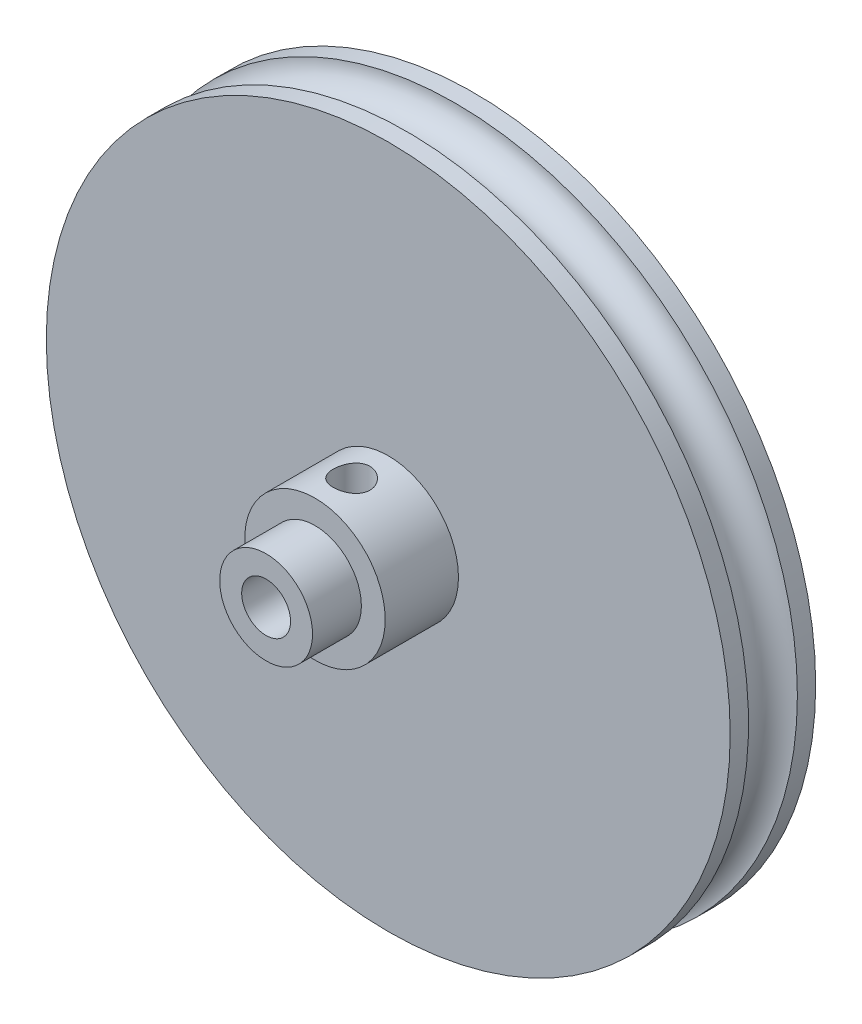
from build123d import *

# Parameters (mm, degrees)
ESQUISSE1_R             = 28
BOSS_EXTRU_1_DEPTH      = 7
ESQUISSE2_R             = 3.8
BOSS_EXTRU_2_DEPTH      = 10
ESQUISSE3_R             = 2
ENL_V_MAT_EXTRU_1_DEPTH = 44.092922853
ESQUISSE4_R             = 2
ESQUISSE5_R             = 5.75
ESQUISSE5_R_2           = 3.8
BOSS_EXTRU_3_DEPTH      = 6
ENL_V_MAT_EXTRU_2_REACH = 45.093
ESQUISSE6_R             = 1.5


with BuildPart() as part:
    # Esquisse1 → Boss.-Extru.1 (new body)
    with BuildSketch(Plane.XY):
        Circle(ESQUISSE1_R)
    extrude(amount=BOSS_EXTRU_1_DEPTH)

    # Esquisse2 → Boss.-Extru.2 (add)
    with BuildSketch(Plane.XY.offset(7)):
        Circle(ESQUISSE2_R)
    extrude(amount=BOSS_EXTRU_2_DEPTH)

    # Esquisse3 → Enlèv. mat.-Extru.1 (cut, through all)
    with BuildSketch(Plane.XY.offset(17)):
        Circle(ESQUISSE3_R)
    extrude(amount=-ENL_V_MAT_EXTRU_1_DEPTH, mode=Mode.SUBTRACT)

    # Esquisse4 → Enlèvement de matière-Révolution1 (revolve, cut)
    with BuildSketch(Plane(origin=(0, 0, 0), x_dir=(0, 0, -1), z_dir=(1, 0, 0))):
        with Locations((-3.5, 28)):
            Circle(ESQUISSE4_R)
    revolve(axis=Axis((0, 0, 0), (0, 0, 1)), mode=Mode.SUBTRACT)

    # Esquisse5 → Boss.-Extru.3 (add)
    with BuildSketch(Plane.XY.offset(7)):
        Circle(ESQUISSE5_R)
        Circle(ESQUISSE5_R_2, mode=Mode.SUBTRACT)
    extrude(amount=BOSS_EXTRU_3_DEPTH)

    # Esquisse6 → Enlèv. mat.-Extru.2 (cut, up to next)
    with BuildSketch(Plane(origin=(0, 0, 0), x_dir=(1, 0, 0), z_dir=(0, 1, 0)), mode=Mode.PRIVATE) as enl_v_mat_extru_2_sk1:
        with Locations((0, -10)):
            Circle(ESQUISSE6_R)
    enl_v_mat_extru_2_tool1 = extrude(enl_v_mat_extru_2_sk1.sketch, amount=ENL_V_MAT_EXTRU_2_REACH, mode=Mode.PRIVATE) & part.part
    add(enl_v_mat_extru_2_tool1.solids().sort_by_distance((0, 0, 10))[0], mode=Mode.SUBTRACT)


solid = part.part
